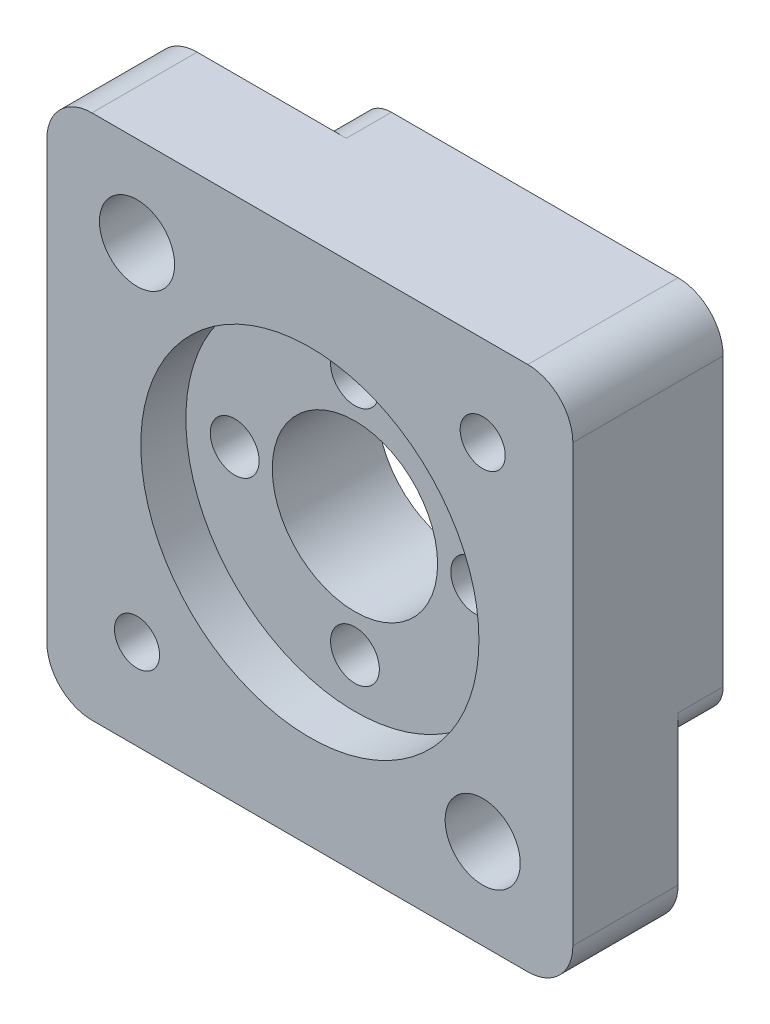
from build123d import *

# Parameters (mm, degrees)
SKETCH1_W           = 35
SKETCH1_H           = 35
SKETCH1_R           = 5.5
SKETCH1_R_2         = 2.5
SKETCH1_R_3         = 1.5
BOSS_EXTRUDE1_DEPTH = 10
FILLET1_R           = 3
SKETCH2_R           = 1.625
CUT_EXTRUDE1_DEPTH  = 10
SKETCH3_R           = 11.25
CUT_EXTRUDE2_DEPTH  = 3
SKETCH5_R           = 2.5
CUT_EXTRUDE4_DEPTH  = 3
FILLET2_R           = 2


with BuildPart() as part:
    # Sketch1 → Boss-Extrude1 (new body)
    with BuildSketch(Plane.XY):
        Rectangle(SKETCH1_W, SKETCH1_H)
        Circle(SKETCH1_R, mode=Mode.SUBTRACT)
        with Locations((-11.5, 11.5)):
            Circle(SKETCH1_R_2, mode=Mode.SUBTRACT)
        with Locations((11.5, 11.5)):
            Circle(SKETCH1_R_3, mode=Mode.SUBTRACT)
        with Locations((11.5, -11.5)):
            Circle(SKETCH1_R_2, mode=Mode.SUBTRACT)
        with Locations((-11.5, -11.5)):
            Circle(SKETCH1_R_3, mode=Mode.SUBTRACT)
    extrude(amount=BOSS_EXTRUDE1_DEPTH)

    # Fillet1
    fillet1_edges = [part.edges().sort_by_distance(p)[0] for p in [
        (17.5, -17.5, 5),
        (-17.5, -17.5, 5),
        (-17.5, 17.5, 5),
        (17.5, 17.5, 5),
    ]]
    fillet(fillet1_edges, radius=FILLET1_R)

    # Sketch2 → Cut-Extrude1 (cut)
    with BuildSketch(Plane.XY.offset(10)):
        with Locations((-8, 0)):
            Circle(SKETCH2_R)
        with Locations((0, 8)):
            Circle(SKETCH2_R)
        with Locations((8, 0)):
            Circle(SKETCH2_R)
        with Locations((0, -8)):
            Circle(SKETCH2_R)
    extrude(amount=-CUT_EXTRUDE1_DEPTH, mode=Mode.SUBTRACT)

    # Sketch3 → Cut-Extrude2 (cut)
    with BuildSketch(Plane.XY.offset(10)):
        Circle(SKETCH3_R)
    extrude(amount=-CUT_EXTRUDE2_DEPTH, mode=Mode.SUBTRACT)

    # Sketch5 → Cut-Extrude4 (cut)
    # profile 1 of 2: a face of its own
    with BuildSketch(Plane(origin=(0, 0, 0), x_dir=(-1, 0, 0), z_dir=(0, 0, -1))):
        with BuildLine():
            Line((-15.742640687, -7.257359313), (-17.5, -9.014718626))
            Line((-17.5, -9.014718626), (-17.5, -14.5))
            ThreePointArc((-17.5, -14.5), (-16.621320344, -16.621320344), (-14.5, -17.5))
            Line((-14.5, -17.5), (-9.014718626, -17.5))
            Line((-9.014718626, -17.5), (-7.257359313, -15.742640687))
            ThreePointArc((-7.257359313, -15.742640687), (-7.257359313, -7.257359313), (-15.742640687, -7.257359313))
        make_face()
        with Locations((-11.5, -11.5)):
            Circle(SKETCH5_R, mode=Mode.SUBTRACT)
    # profile 2 of 2: a face of its own
    with BuildSketch(Plane(origin=(0, 0, 0), x_dir=(-1, 0, 0), z_dir=(0, 0, -1))):
        with BuildLine():
            Line((9.014718626, 17.5), (7.257359313, 15.742640687))
            ThreePointArc((7.257359313, 15.742640687), (7.257359313, 7.257359313), (15.742640687, 7.257359313))
            Line((15.742640687, 7.257359313), (17.5, 9.014718626))
            Line((17.5, 9.014718626), (17.5, 14.5))
            ThreePointArc((17.5, 14.5), (16.621320344, 16.621320344), (14.5, 17.5))
            Line((14.5, 17.5), (9.014718626, 17.5))
        make_face()
        with Locations((11.5, 11.5)):
            Circle(SKETCH5_R, mode=Mode.SUBTRACT)
    extrude(amount=-CUT_EXTRUDE4_DEPTH, mode=Mode.SUBTRACT)

    # Fillet2
    # the kernel refuses this fillet: 2 mm, written as the material it takes off along each edge
    with BuildSketch(Plane(origin=(-9.014718626, 17.5, -11.10730464), x_dir=(0.6704488170211711, -0.7419557828839344, 0), z_dir=(0, 0, 1))) as fillet2_piece_1:
        with BuildLine():
            CenterArc((4.462663268, 1.95555393), FILLET2_R, 137.89828583, 120)
            Line((2.978751702, 3.296451564), (2.830360546, 3.430541327))
            Line((2.830360546, 3.430541327), (-0.148391157, 0.134089763))
            Line((-0.148391157, 0.134089763), (0.010112612, -0.199744174))
            ThreePointArc((0.010112612, -0.199744174), (2.492214989, -0.074080742), (4.001438073, -0.195555393))
            Line((4.001438073, -0.195555393), (4.043367636, 0))
        make_face()
    extrude(amount=14.10730464, mode=Mode.SUBTRACT)
    with BuildSketch(Plane(origin=(-17.5, 9.014718626, -11.10730464), x_dir=(0, -1, 0), z_dir=(0, 0, 1)), Plane(origin=(17.5, -9.014718626, -11.10730464), x_dir=(0, 1, 0), z_dir=(0, 0, 1))) as fillet2_piece_2:
        with BuildLine():
            CenterArc((4.442921856, 2), FILLET2_R, 150, 120)
            Line((2.710871048, 3), (2.537665968, 3.1))
            ThreePointArc((2.537665968, 3.1), (1.615937957, 1.898780669), (-0.141421356, 0.141421356))
            Line((-0.141421356, 0.141421356), (0, -0.2))
            Line((0, -0.2), (4.442921856, -0.2))
            Line((4.442921856, -0.2), (4.442921856, 0))
        make_face()
    extrude(amount=14.10730464, mode=Mode.SUBTRACT)
    with BuildSketch(Plane(origin=(9.014718626, -17.5, -11.10730464), x_dir=(-1, 0, 0), z_dir=(0, 0, 1))) as fillet2_piece_3:
        with BuildLine():
            CenterArc((4.442921856, -2), FILLET2_R, 90, 120)
            Line((2.710871048, -3), (2.537665968, -3.1))
            ThreePointArc((2.537665968, -3.1), (1.615937957, -1.898780669), (-0.141421356, -0.141421356))
            Line((-0.141421356, -0.141421356), (0, 0.2))
            Line((0, 0.2), (4.442921856, 0.2))
            Line((4.442921856, 0.2), (4.442921856, 0))
        make_face()
    extrude(amount=14.10730464, mode=Mode.SUBTRACT)


solid = part.part
